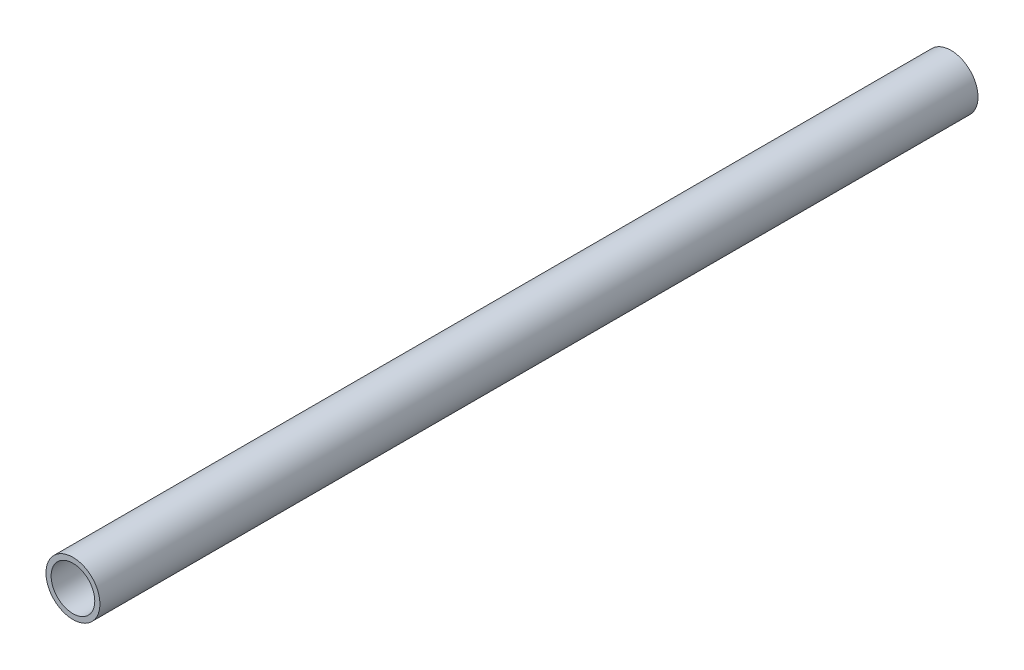
from build123d import *

# Parameters (mm, degrees)
SKETCH1_R           = 8.001
SKETCH1_R_2         = 6.477
BOSS_EXTRUDE1_DEPTH = 260.35


with BuildPart() as part:
    # Sketch1 → Boss-Extrude1 (new body)
    with BuildSketch(Plane.XY):
        Circle(SKETCH1_R)
        Circle(SKETCH1_R_2, mode=Mode.SUBTRACT)
    extrude(amount=BOSS_EXTRUDE1_DEPTH)


solid = part.part
